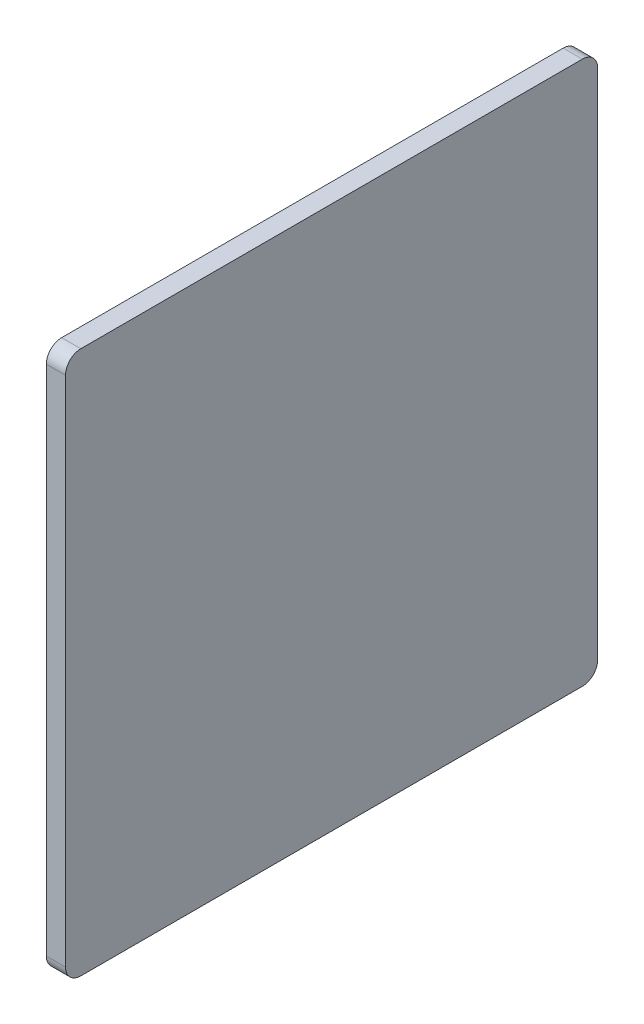
from build123d import *

# Parameters (mm, degrees)
SKETCH1_W           = 88.175
SKETCH1_H           = 90
BOSS_EXTRUDE1_DEPTH = 3.175
FILLET1_R           = 2.54


with BuildPart() as part:
    # Sketch1 → Boss-Extrude1 (new body)
    with BuildSketch(Plane(origin=(0, 0, 0), x_dir=(0, 0, -1), z_dir=(1, 0, 0))):
        Rectangle(SKETCH1_W, SKETCH1_H)
    extrude(amount=BOSS_EXTRUDE1_DEPTH)

    # Fillet1
    fillet1_edges = [part.edges().sort_by_distance(p)[0] for p in [
        (1.5875, -45, 44.0875),
        (1.5875, -45, -44.0875),
        (1.5875, 45, -44.0875),
        (1.5875, 45, 44.0875),
    ]]
    fillet(fillet1_edges, radius=FILLET1_R)


solid = part.part
